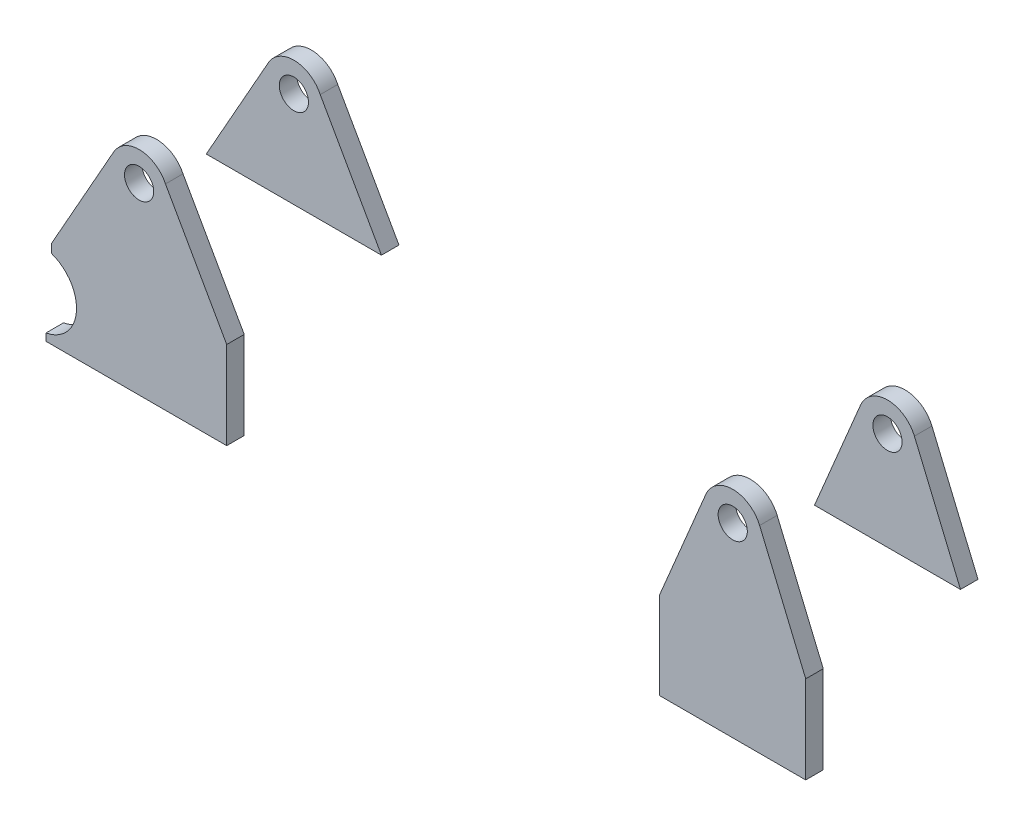
from build123d import *

# Parameters (mm, degrees)
BOSS_EXTRUDE1_DEPTH   = 6
BOSS_EXTRUDE1_2_DEPTH = 6
SKETCH2_R             = 5
BOSS_EXTRUDE2_DEPTH   = 6
BOSS_EXTRUDE2_2_DEPTH = 6


with BuildPart() as part:
    # Sketch1 → Boss-Extrude1 (new body)
    with BuildSketch(Plane.XY):
        with BuildLine():
            Line((-716.13985876, -515.575791083), (-737.428628659, -553.340939132))
            Line((-737.428628659, -553.340939132), (-737.428628659, -556.331911188))
            ThreePointArc((-737.428628659, -556.331911188), (-728.897619582, -569.315366927), (-739.314405274, -580.840939132))
            Line((-739.314405274, -580.840939132), (-739.314405274, -583.340939132))
            Line((-739.314405274, -583.340939132), (-677.428628659, -583.340939132))
            Line((-677.428628659, -583.340939132), (-677.428628659, -553.340939132))
            Line((-677.428628659, -553.340939132), (-698.394630659, -516.198447176))
            ThreePointArc((-698.394630659, -516.198447176), (-707.077957971, -510.492590118), (-716.13985876, -515.575791083))
        make_face()
        with BuildLine():
            add(Edge.make_bspline(
                [(-702.428724913, -520.517464399), (-702.366675575, -510.517656907), (-712.366483068, -510.455607569), (-712.428532405, -520.455415061), (-712.490581742, -530.455222553), (-702.49077425, -530.517271891), (-702.428724913, -520.517464399)],
                knots=[0, 0, 0, 0, 0.5, 0.5, 0.5, 1, 1, 1, 1], degree=3, weights=[1, 0.333333333, 0.333333333, 1, 0.333333333, 0.333333333, 1]))
        make_face(mode=Mode.SUBTRACT)
    extrude(amount=BOSS_EXTRUDE1_DEPTH)


with BuildPart() as body_2:
    # Sketch1 → Boss-Extrude1 2 (new body)
    with BuildSketch(Plane.XY):
        with BuildLine():
            Line((-513.347372822, -515.745542754), (-529.126603186, -553.340939132))
            Line((-529.126603186, -553.340939132), (-529.126603186, -583.340939132))
            Line((-529.126603186, -583.340939132), (-479.126603186, -583.340939132))
            Line((-479.126603186, -583.340939132), (-479.126603186, -553.340939132))
            Line((-479.126603186, -553.340939132), (-494.905833551, -515.745542754))
            ThreePointArc((-494.905833551, -515.745542754), (-504.126603186, -509.6156083), (-513.347372822, -515.745542754))
        make_face()
        with BuildLine():
            add(Edge.make_bspline(
                [(-499.12669944, -519.646632969), (-499.064650103, -509.646825477), (-509.064457595, -509.58477614), (-509.126506932, -519.584583632), (-509.188556269, -529.584391124), (-499.188748777, -529.646440461), (-499.12669944, -519.646632969)],
                knots=[0, 0, 0, 0, 0.5, 0.5, 0.5, 1, 1, 1, 1], degree=3, weights=[1, 0.333333333, 0.333333333, 1, 0.333333333, 0.333333333, 1]))
        make_face(mode=Mode.SUBTRACT)
    extrude(amount=BOSS_EXTRUDE1_2_DEPTH)


with BuildPart() as body_3:
    # Sketch2 → Boss-Extrude2 (new body)
    with BuildSketch(Plane(origin=(0, 0, -47), x_dir=(-1, 0, 0), z_dir=(0, 0, -1))):
        with BuildLine():
            Line((479.126603186, -553.340939132), (529.126603186, -553.340939132))
            Line((529.126603186, -553.340939132), (513.347372822, -515.745542754))
            ThreePointArc((513.347372822, -515.745542754), (504.126603186, -509.6156083), (494.905833551, -515.745542754))
            Line((494.905833551, -515.745542754), (479.126603186, -553.340939132))
        make_face()
        with Locations((504.126603186, -519.6156083)):
            Circle(SKETCH2_R, mode=Mode.SUBTRACT)
    extrude(amount=BOSS_EXTRUDE2_DEPTH)


with BuildPart() as body_4:
    # Sketch2 → Boss-Extrude2 2 (new body)
    with BuildSketch(Plane(origin=(0, 0, -47), x_dir=(-1, 0, 0), z_dir=(0, 0, -1))):
        with BuildLine():
            Line((677.428628659, -553.340939132), (737.428628659, -553.340939132))
            Line((737.428628659, -553.340939132), (716.13985876, -515.575791083))
            ThreePointArc((716.13985876, -515.575791083), (707.077957971, -510.492590118), (698.394630659, -516.198447176))
            Line((698.394630659, -516.198447176), (677.428628659, -553.340939132))
        make_face()
        with Locations((707.428628659, -520.48643973)):
            Circle(SKETCH2_R, mode=Mode.SUBTRACT)
    extrude(amount=BOSS_EXTRUDE2_2_DEPTH)


solid = Compound([part.part, body_2.part, body_3.part, body_4.part])
